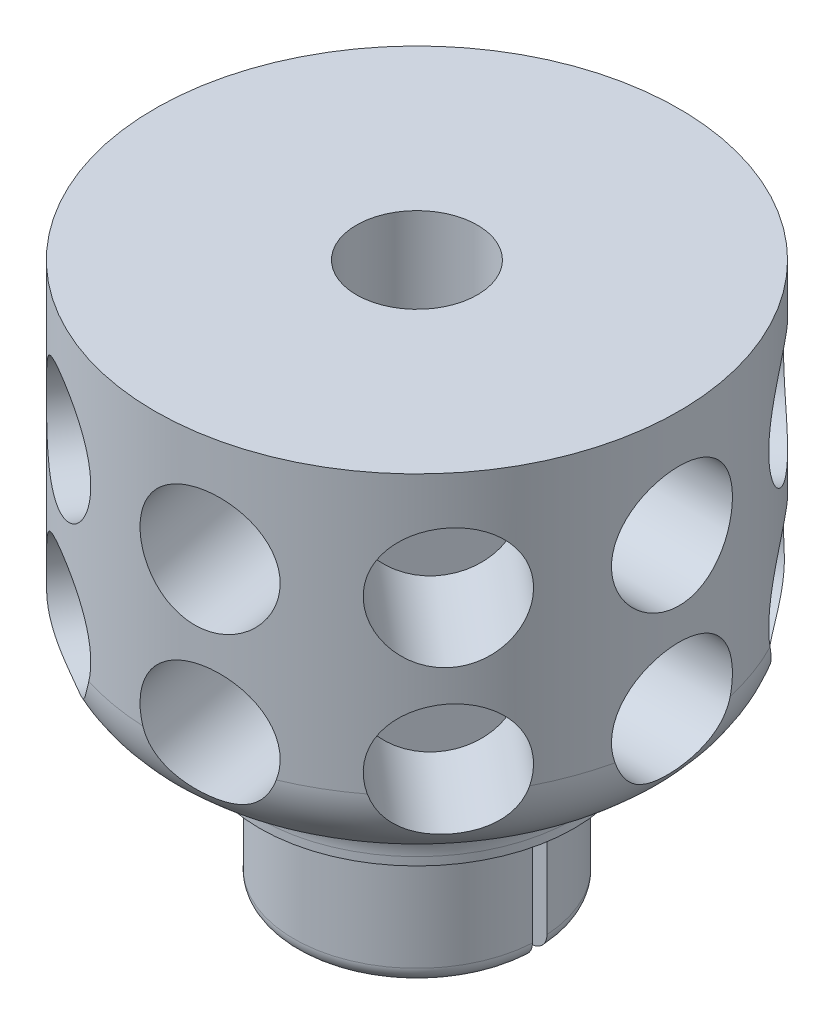
from build123d import *

# Parameters (mm, degrees)
SKETCH1_R           = 32.5
BOSS_EXTRUDE1_DEPTH = 44.3
SKETCH3_R           = 19.5
BOSS_EXTRUDE2_DEPTH = 7
SKETCH4_R           = 15.25
BOSS_EXTRUDE3_DEPTH = 16
FILLET1_R           = 6
SKETCH7_W           = 66.193685288
SKETCH7_H           = 1.806726502
CUT_EXTRUDE2_DEPTH  = 16
FILLET2_R           = 2
SKETCH11_W          = 6.8
SKETCH11_H          = 9
BOSS_EXTRUDE4_DEPTH = 44.3
SKETCH14_R          = 7.5
CUT_EXTRUDE6_DEPTH  = 14
CIRPATTERN4_COUNT   = 9
FILLET3_R           = 10
SKETCH15_R          = 7.5
CUT_EXTRUDE7_DEPTH  = 82.497178028


with BuildPart() as part:
    # Sketch1 → Boss-Extrude1 (new body)
    with BuildSketch(Plane(origin=(0, 0, 0), x_dir=(1, 0, 0), z_dir=(0, 1, 0))):
        with Locations(Location((0, 0, 0), (0, 0, 270))):
            Circle(SKETCH1_R)
    extrude(amount=BOSS_EXTRUDE1_DEPTH)

    # Sketch3 → Boss-Extrude2 (add)
    with BuildSketch(Plane.XZ):
        with Locations(Location((0, 0, 0), (0, 0, 270))):
            Circle(SKETCH3_R)
    extrude(amount=BOSS_EXTRUDE2_DEPTH)

    # Sketch4 → Boss-Extrude3 (add)
    with BuildSketch(Plane.XZ.offset(7)):
        with Locations(Location((0, 0, 0), (0, 0, 270))):
            Circle(SKETCH4_R)
    extrude(amount=BOSS_EXTRUDE3_DEPTH)

    # Fillet1
    fillet1_edges = [part.edges().sort_by_distance(p)[0] for p in [
        (0, 0, 19.5),
    ]]
    fillet(fillet1_edges, radius=FILLET1_R)

    # Sketch7 → Cut-Extrude2 (cut)
    with BuildSketch(Plane.XZ.offset(23)):
        Rectangle(SKETCH7_W, SKETCH7_H)
    extrude(amount=-CUT_EXTRUDE2_DEPTH, mode=Mode.SUBTRACT)

    # Fillet2
    fillet2_edges = [part.edges().sort_by_distance(p)[0] for p in [
        (0, -23, 15.25),
        (0, -23, -15.25),
    ]]
    fillet(fillet2_edges, radius=FILLET2_R)

    # Sketch11 → Boss-Extrude4 (add)
    with BuildSketch(Plane(origin=(0, 44.3, 0), x_dir=(1, 0, 0), z_dir=(0, 1, 0))):
        with Locations((0, 27.821664561)):
            Rectangle(SKETCH11_W, SKETCH11_H)
    extrude(amount=-BOSS_EXTRUDE4_DEPTH)

    # Sketch14 → Cut-Extrude6 (cut)
    with BuildSketch(Plane(origin=(32.5, 0, 0), x_dir=(0, 0, -1), z_dir=(1, 0, 0))):
        with Locations((0, 12)):
            Circle(SKETCH14_R)
        with Locations((0, 30.911053904)):
            Circle(SKETCH14_R)
    cut_extrude6 = extrude(amount=-CUT_EXTRUDE6_DEPTH, mode=Mode.SUBTRACT)

    # CirPattern4: Cut-Extrude6 ×9 about axis
    cirpattern4_axis = Axis((0, 0, 0), (0, 1, 0))
    for i in range(1, CIRPATTERN4_COUNT):
        add(cut_extrude6.rotate(cirpattern4_axis, i * 360 / CIRPATTERN4_COUNT), mode=Mode.SUBTRACT)

    # Fillet3
    # the kernel refuses this fillet: 10 mm, written as the material it takes off along each edge
    with BuildSketch(Plane(origin=(0, 0, 0), x_dir=(0, 0, 1), z_dir=(1, 0, 0))) as fillet3_piece_1:
        with BuildLine():
            CenterArc((22.5, -9.716233646), FILLET3_R, 360, 79.193077125)
            Line((32.5, -9.716233646), (33.5, -9.716233646))
            Line((33.5, -9.716233646), (33.5, 0))
            Line((33.5, 0), (32.5, 1))
            ThreePointArc((32.5, 1), (25.5, 1), (24.5625, 1.088676986))
            Line((24.5625, 1.088676986), (24.375, 0.106412383))
        make_face()
    revolve(axis=Axis((0, 0, 0), (0, -1, 0)), mode=Mode.SUBTRACT)

    # Sketch15 → Cut-Extrude7 (cut, through all)
    with BuildSketch(Plane(origin=(0, 44.3, 0), x_dir=(1, 0, 0), z_dir=(0, 1, 0))):
        with Locations(Location((0, 0, 0), (0, 0, 270))):
            Circle(SKETCH15_R)
    extrude(amount=-CUT_EXTRUDE7_DEPTH, mode=Mode.SUBTRACT)


solid = part.part
